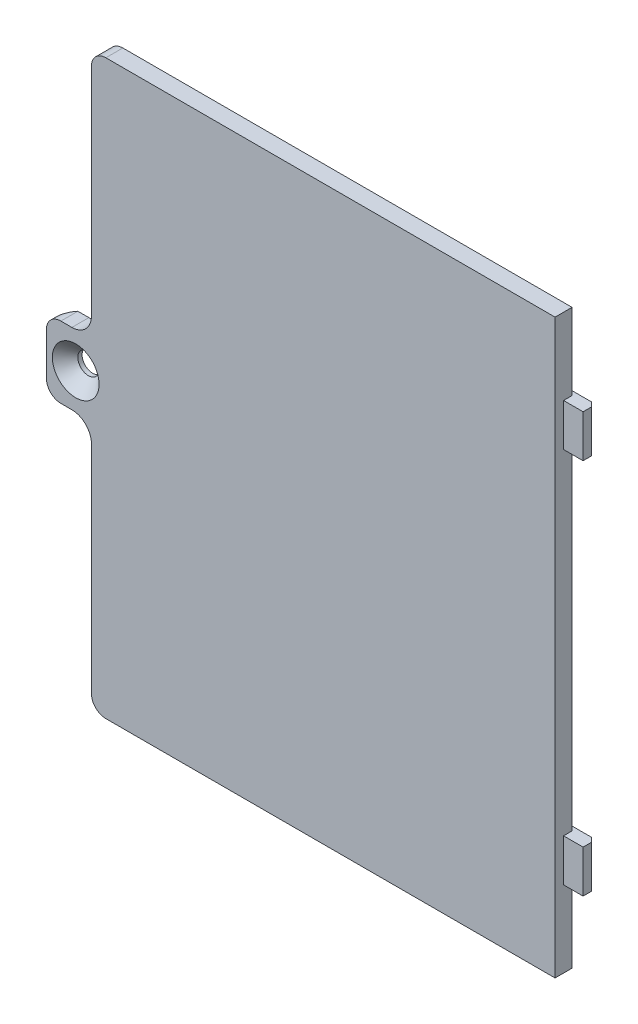
from build123d import *

# Parameters (mm, degrees)
BOSS_EXTRUDE1_DEPTH = 1
BOSS_EXTRUDE2_START = 1
BOSS_EXTRUDE2_DEPTH = 1
CUT_EXTRUDE1_REACH  = 128.037
CUT_EXTRUDE2_REACH  = 126.851
SKETCH4_R           = 1.25
CHAMFER1_SIZE       = 1.5
SKETCH5_W           = 55.9
SKETCH5_H           = 5
BOSS_EXTRUDE3_DEPTH = 1.5
CHAMFER3_SIZE       = 0.5


with BuildPart() as part:
    # Sketch1 → Boss-Extrude1 (new body)
    with BuildSketch(Plane.XY):
        with BuildLine():
            Line((67.3, -33.7), (112.5, -33.7))
            Line((112.5, -33.7), (120.2, -33.7))
            Line((120.2, -33.7), (120.2, 33.7))
            Line((120.2, 33.7), (112.5, 33.7))
            Line((112.5, 33.7), (67.3, 33.7))
            ThreePointArc((67.3, 33.7), (66.097918472, 33.202081528), (65.6, 32))
            Line((65.6, 32), (65.6, 6.5))
            ThreePointArc((65.6, 6.5), (64.926345597, 4.873654403), (63.3, 4.2))
            Line((63.3, 4.2), (62, 4.2))
            ThreePointArc((62, 4.2), (60.797918472, 3.702081528), (60.3, 2.5))
            Line((60.3, 2.5), (60.3, -2.5))
            ThreePointArc((60.3, -2.5), (60.797918472, -3.702081528), (62, -4.2))
            Line((62, -4.2), (63.3, -4.2))
            ThreePointArc((63.3, -4.2), (64.926345597, -4.873654403), (65.6, -6.5))
            Line((65.6, -6.5), (65.6, -32))
            ThreePointArc((65.6, -32), (66.097918472, -33.202081528), (67.3, -33.7))
        make_face()
    extrude(amount=BOSS_EXTRUDE1_DEPTH)

    # Sketch2 → Boss-Extrude2 (add)
    with BuildSketch(Plane(origin=(0, 0, 0), x_dir=(-1, 0, 0), z_dir=(0, 0, -1)).offset(BOSS_EXTRUDE2_START)):
        with BuildLine():
            Line((-67.3, 33.7), (-120.2, 33.7))
            Line((-120.2, 33.7), (-120.2, -33.7))
            Line((-120.2, -33.7), (-67.3, -33.7))
            ThreePointArc((-67.3, -33.7), (-66.097918472, -33.202081528), (-65.6, -32))
            Line((-65.6, -32), (-65.6, -6.5))
            ThreePointArc((-65.6, -6.5), (-64.926345597, -4.873654403), (-63.3, -4.2))
            Line((-63.3, -4.2), (-62, -4.2))
            ThreePointArc((-62, -4.2), (-60.797918472, -3.702081528), (-60.3, -2.5))
            Line((-60.3, -2.5), (-60.3, 2.5))
            ThreePointArc((-60.3, 2.5), (-60.797918472, 3.702081528), (-62, 4.2))
            Line((-62, 4.2), (-63.3, 4.2))
            ThreePointArc((-63.3, 4.2), (-64.926345597, 4.873654403), (-65.6, 6.5))
            Line((-65.6, 6.5), (-65.6, 32))
            ThreePointArc((-65.6, 32), (-66.097918472, 33.202081528), (-67.3, 33.7))
        make_face()
        with BuildLine():
            Line((-67.3, 32.7), (-119.2, 32.7))
            Line((-119.2, 32.7), (-119.2, -32.7))
            Line((-119.2, -32.7), (-67.3, -32.7))
            ThreePointArc((-67.3, -32.7), (-66.805025253, -32.494974747), (-66.6, -32))
            Line((-66.6, -32), (-66.6, -6.5))
            Line((-66.6, -6.5), (-66.6, 6.5))
            Line((-66.6, 6.5), (-66.6, 32))
            ThreePointArc((-66.6, 32), (-66.805025253, 32.494974747), (-67.3, 32.7))
        make_face(mode=Mode.SUBTRACT)
    extrude(amount=-BOSS_EXTRUDE2_DEPTH)

    # Cut-Extrude1: up to this face of the body (flat: up to its plane)
    cut_extrude1_end = Plane(part.part.faces().sort_by_distance((62.65, -4.2, 0))[0])
    # Sketch3 → Cut-Extrude1 (cut, up to the picked face)
    with BuildSketch(Plane(origin=(0, 4.2, 0), x_dir=(1, 0, 0), z_dir=(0, 1, 0)), mode=Mode.PRIVATE) as cut_extrude1_sk1:
        Polygon((62, 1), (60.3, -1), (60.3, 1), align=None)
    cut_extrude1_tool1 = split(extrude(cut_extrude1_sk1.sketch, amount=-CUT_EXTRUDE1_REACH, mode=Mode.PRIVATE), bisect_by=cut_extrude1_end, keep=Keep.BOTH, mode=Mode.PRIVATE)
    add(cut_extrude1_tool1.solids().sort_by(Axis((60.866667, 4.2, -0.333333), (0, -1, 0)))[0], mode=Mode.SUBTRACT)

    # Sketch4 → Cut-Extrude2 (cut, up to next)
    with BuildSketch(Plane(origin=(0, 0, -1), x_dir=(-1, 0, 0), z_dir=(0, 0, -1)), mode=Mode.PRIVATE) as cut_extrude2_sk1:
        with Locations((-63.75, 0)):
            Circle(SKETCH4_R)
    cut_extrude2_tool1 = extrude(cut_extrude2_sk1.sketch, amount=-CUT_EXTRUDE2_REACH, mode=Mode.PRIVATE) & part.part
    add(cut_extrude2_tool1.solids().sort_by_distance((63.75, 0, -1))[0], mode=Mode.SUBTRACT)

    # Chamfer1
    chamfer1_edges = [part.edges().sort_by_distance(p)[0] for p in [
        (65, 0, 1),
    ]]
    chamfer(chamfer1_edges, length=CHAMFER1_SIZE)

    # Sketch5 → Boss-Extrude3 (add)
    with BuildSketch(Plane(origin=(0, 0, 0), x_dir=(-1, 0, 0), z_dir=(0, 0, -1))):
        with Locations((-94.55, -22.2)):
            Rectangle(SKETCH5_W, SKETCH5_H)
        with Locations((-94.55, 22.2)):
            Rectangle(SKETCH5_W, SKETCH5_H)
    extrude(amount=BOSS_EXTRUDE3_DEPTH)

    # Chamfer3
    chamfer3_edges = [part.edges().sort_by_distance(p)[0] for p in [
        (122.5, 22.2, -1.5),
        (122.5, -22.2, -1.5),
        (66.6, -22.2, -1.5),
        (66.6, 22.2, -1.5),
    ]]
    chamfer(chamfer3_edges, length=CHAMFER3_SIZE - 0.0001)  # a hair under: the kernel refuses the full size


solid = part.part
